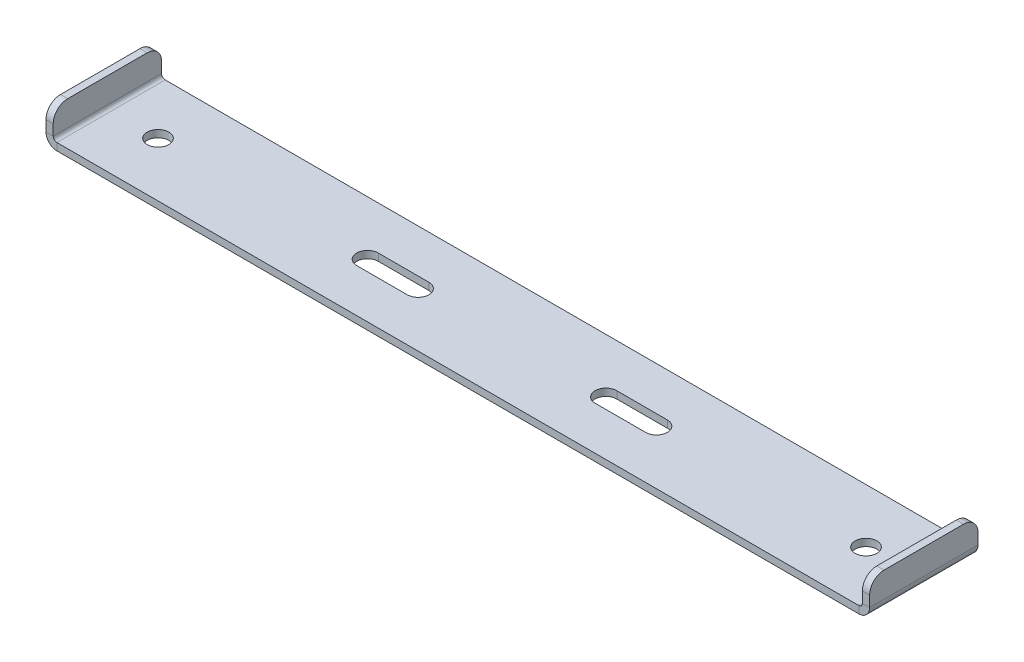
from build123d import *

# Parameters (mm, degrees)
SKETCH_1_W                         = 114
SKETCH_1_H                         = 15
EXTRUDE_1_DEPTH                    = 1
SM_EDGE_FLANGE_1_STRIP_W           = 5
SM_EDGE_FLANGE_1_STRIP_H           = 1
SM_EDGE_FLANGE_1_STRIP_CUT_DEPTH   = 15
SM_EDGE_FLANGE_1_STRIP_2_W         = 5
SM_EDGE_FLANGE_1_STRIP_2_H         = 1
SM_EDGE_FLANGE_1_STRIP_CUT_2_DEPTH = 15
SM_EDGE_FLANGE_1_DEPTH             = 15
SM_EDGE_FLANGE_1_BEND_DEPTH        = 15
CUT_EXTRUDE_1_DEPTH                = 58.630287176
SKETCH_13_R                        = 1.5
CUT_EXTRUDE_2_DEPTH                = 5
FILLET_1_R                         = 2


# Sheet-metal steps are written as plain solids
with BuildPart() as part:
    # Sketch 1 → Бобышка-Вытянуть1 (new body)
    with BuildSketch(Plane(origin=(0, 0, 0), x_dir=(1, 0, 0), z_dir=(0, 1, 0))):
        Rectangle(SKETCH_1_W, SKETCH_1_H)
    extrude(amount=EXTRUDE_1_DEPTH)

    # Ребро-кромка1 strip (across the edge) → Ребро-кромка1 strip cut (cut)
    with BuildSketch(Plane(origin=(57, 1, 7.5), x_dir=(-1, 0, 0), z_dir=(0, 0, -1))):
        with Locations((-1, -0.5)):
            Rectangle(SM_EDGE_FLANGE_1_STRIP_W, SM_EDGE_FLANGE_1_STRIP_H)
    extrude(amount=SM_EDGE_FLANGE_1_STRIP_CUT_DEPTH, mode=Mode.SUBTRACT)

    # Ребро-кромка1 strip 2 (across the edge) → Ребро-кромка1 strip cut 2 (cut)
    with BuildSketch(Plane(origin=(-57, 1, -7.5), x_dir=(1, 0, 0), z_dir=(0, 0, 1))):
        with Locations((-1, -0.5)):
            Rectangle(SM_EDGE_FLANGE_1_STRIP_2_W, SM_EDGE_FLANGE_1_STRIP_2_H)
    extrude(amount=SM_EDGE_FLANGE_1_STRIP_CUT_2_DEPTH, mode=Mode.SUBTRACT)

    # Ребро-кромка1 section (across the edge) → Ребро-кромка1 (add)
    with BuildSketch(Plane(origin=(57, 1, 7.5), x_dir=(-1, 0, 0), z_dir=(0, 0, -1))):
        with BuildLine():
            Line((0, 0.5), (0, 4))
            Line((0, 4), (1, 4))
            Line((1, 4), (1, 0.5))
            ThreePointArc((1, 0.5), (1.146446609, 0.146446609), (1.5, 0))
            Line((1.5, 0), (1.5, -1))
            ThreePointArc((1.5, -1), (0.439339828, -0.560660172), (0, 0.5))
        make_face()
    extrude(amount=SM_EDGE_FLANGE_1_DEPTH)

    # Ребро-кромка1 section 2 (across the edge) → Ребро-кромка1 bend (add)
    with BuildSketch(Plane(origin=(-57, 1, -7.5), x_dir=(1, 0, 0), z_dir=(0, 0, 1))):
        with BuildLine():
            Line((0, 0.5), (0, 4))
            Line((0, 4), (1, 4))
            Line((1, 4), (1, 0.5))
            ThreePointArc((1, 0.5), (1.146446609, 0.146446609), (1.5, 0))
            Line((1.5, 0), (1.5, -1))
            ThreePointArc((1.5, -1), (0.439339828, -0.560660172), (0, 0.5))
        make_face()
    extrude(amount=SM_EDGE_FLANGE_1_BEND_DEPTH)

    # Эскиз12 → Вырез-Вытянуть1 (cut, through all)
    with BuildSketch(Plane(origin=(0, 1, 0), x_dir=(1, 0, 0), z_dir=(0, 1, 0))):
        with BuildLine():
            Line((-20, 1.5), (-13, 1.5))
            ThreePointArc((-13, 1.5), (-11.5, 0), (-13, -1.5))
            Line((-13, -1.5), (-20, -1.5))
            ThreePointArc((-20, -1.5), (-21.5, 0), (-20, 1.5))
        make_face()
        with BuildLine():
            Line((20, 1.5), (13, 1.5))
            ThreePointArc((13, 1.5), (11.5, 0), (13, -1.5))
            Line((13, -1.5), (20, -1.5))
            ThreePointArc((20, -1.5), (21.5, 0), (20, 1.5))
        make_face()
    extrude(amount=-CUT_EXTRUDE_1_DEPTH, mode=Mode.SUBTRACT)

    # Эскиз13 → Вырез-Вытянуть2 (cut)
    with BuildSketch(Plane(origin=(0, 1, 0), x_dir=(1, 0, 0), z_dir=(0, 1, 0))):
        with Locations(Location((-49, 0, 0), (0, 0, 270))):
            Circle(SKETCH_13_R)
        with Locations(Location((49, 0, 0), (0, 0, 270))):
            Circle(SKETCH_13_R)
    extrude(amount=-CUT_EXTRUDE_2_DEPTH, mode=Mode.SUBTRACT)

    # Скругление1
    fillet_1_edges = [part.edges().sort_by_distance(p)[0] for p in [
        (56.5, 5, 7.5),
        (56.5, 5, -7.5),
        (-56.5, 5, -7.5),
        (-56.5, 5, 7.5),
    ]]
    fillet(fillet_1_edges, radius=FILLET_1_R)


solid = part.part
